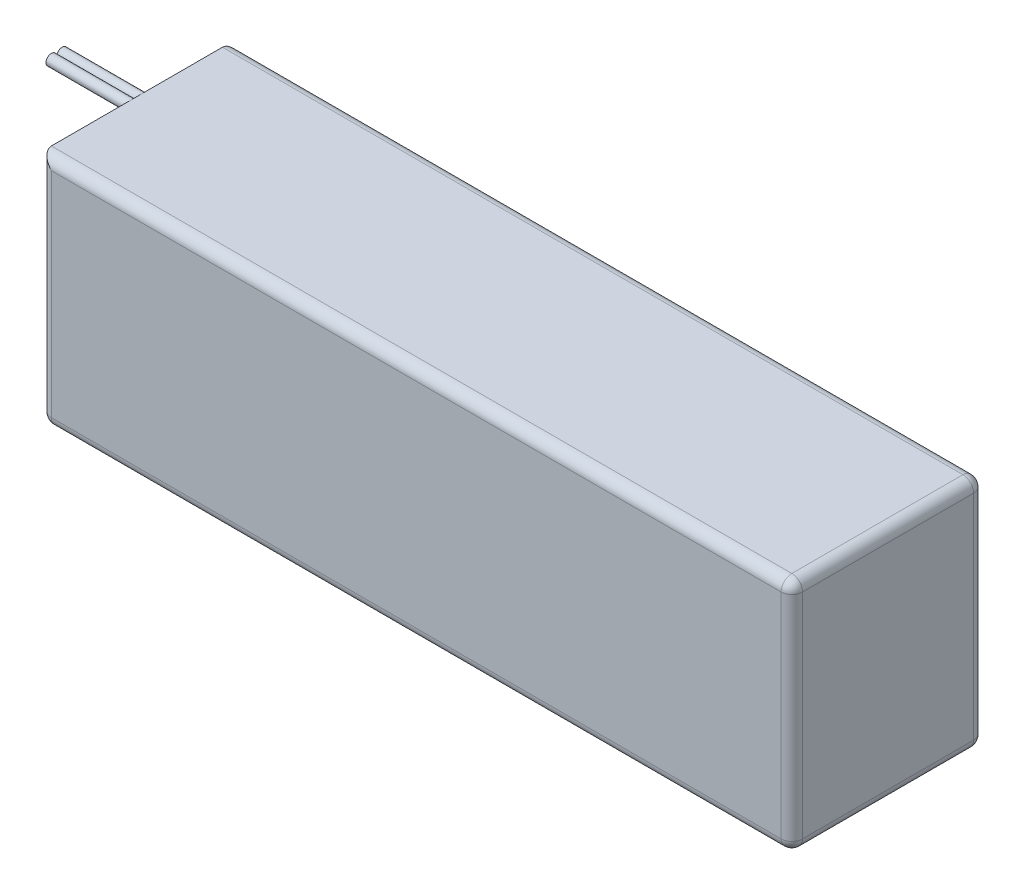
from build123d import *

# Parameters (mm, degrees)
SKETCH1_W             = 140.5
SKETCH1_H             = 44
BOSS_EXTRUDE1_DEPTH   = 36
SKETCH2_R             = 1
BOSS_EXTRUDE4_DEPTH   = 15
BOSS_EXTRUDE4_2_DEPTH = 15
FILLET1_R             = 2


with BuildPart() as part:
    # Sketch1 → Boss-Extrude1 (new body)
    with BuildSketch(Plane.XY):
        Rectangle(SKETCH1_W, SKETCH1_H)
    extrude(amount=BOSS_EXTRUDE1_DEPTH)

    # Fillet1
    fillet1_edges = [part.edges().sort_by_distance(p)[0] for p in [
        (-70.25, 0, 0),
        (-70.25, -22, 18),
        (0, -22, 0),
        (70.25, -22, 18),
        (70.25, 0, 0),
        (0, -22, 36),
        (-70.25, 0, 36),
        (70.25, 0, 36),
        (70.25, 22, 18),
        (0, 22, 36),
        (0, 22, 0),
    ]]
    fillet(fillet1_edges, radius=FILLET1_R)


with BuildPart() as body_2:
    # Sketch2 → Boss-Extrude4 (new body)
    with BuildSketch(Plane.ZY.offset(70.25)):
        with Locations((16.995, 21)):
            Circle(SKETCH2_R)
    extrude(amount=BOSS_EXTRUDE4_DEPTH)


with BuildPart() as body_3:
    # Sketch2 → Boss-Extrude4 2 (new body)
    with BuildSketch(Plane.ZY.offset(70.25)):
        with Locations((19.005, 21)):
            Circle(SKETCH2_R)
    extrude(amount=BOSS_EXTRUDE4_2_DEPTH)


solid = Compound([part.part, body_2.part, body_3.part])
